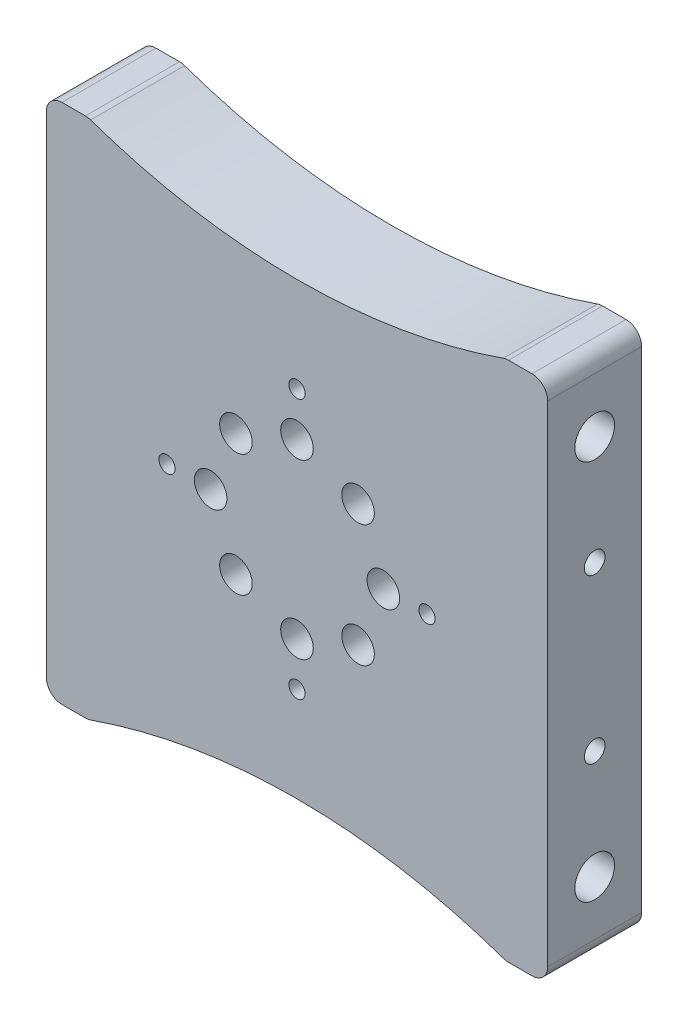
from build123d import *

# Parameters (mm, degrees)
BOSS_EXTRUDE1_DEPTH                         = 19.05
F_1_3_4_CLEARANCE_HOLE1_D                   = 45
F_1_3_4_CLEARANCE_HOLE1_DEPTH               = 5
F_1_4_CLEARANCE_HOLE3_D                     = 6.6
F_1_4_CLEARANCE_HOLE3_DEPTH                 = 19.05
BOSS_EXTRUDE2_DEPTH                         = 19.05
SKETCH21_R                                  = 30
CUT_EXTRUDE1_DEPTH                          = 81.6728269
BOSS_EXTRUDE5_DEPTH                         = 19.05
BOSS_EXTRUDE6_DEPTH                         = 19.05
FILLET2_R                                   = 13
SKETCH29_W                                  = 12.7
SKETCH29_H                                  = 60
BOSS_EXTRUDE7_DEPTH                         = 19.05
BOSS_EXTRUDE8_START                         = -19.05
BOSS_EXTRUDE8_DEPTH                         = 19.05
FILLET3_R                                   = 3.175
F_8_0MM_DOWEL_HOLE1_AT_2_COUNT              = 2
F_8_0MM_DOWEL_HOLE1_AT_2_PITCH              = 77.249249372
TAPPED_HOLE_FOR_M4X0_7_HELICOIL1_AT_2_COUNT = 2
TAPPED_HOLE_FOR_M4X0_7_HELICOIL1_AT_2_PITCH = 33.106821059
F_4_CLEARANCE_HOLE2_D                       = 3.2999934


# Read off the part's stored shape, not the designer's step: Markup2
with BuildPart() as part:
    # Sketch1 → Boss-Extrude1 (new body)
    with BuildSketch(Plane(origin=(0, 0, 0), x_dir=(-1, 0, 0), z_dir=(0, 0, -1))):
        with BuildLine():
            Line((44.45, 0), (44.45, 60))
            Line((44.45, 60), (-44.45, 60))
            Line((-44.45, 60), (-44.45, 0))
            ThreePointArc((-44.45, 0), (0, -44.45), (44.45, 0))
        make_face()
    extrude(amount=-BOSS_EXTRUDE1_DEPTH)

    # 1-3/4 Clearance Hole1
    with Locations(Plane(origin=(0, 0, 0), x_dir=(-1, 0, 0), z_dir=(0, 0, -1))):
        with Locations((-6, 0)):
            Hole(F_1_3_4_CLEARANCE_HOLE1_D / 2, depth=F_1_3_4_CLEARANCE_HOLE1_DEPTH)

    # 1/4 Clearance Hole3
    with Locations(Plane.XY.offset(19.05)):
        with Locations((18.374368671, 12.374368671), (23.499999956, -0.001247108), (18.374368671, -12.374368671), (6, -17.5), (-6.374368671, -12.374368671), (-11.5, 0), (-6.374368671, 12.374368671), (6, 17.5)):
            Hole(F_1_4_CLEARANCE_HOLE3_D / 2, depth=F_1_4_CLEARANCE_HOLE3_DEPTH)

    # Sketch18 → Boss-Extrude2 (add)
    with BuildSketch(Plane(origin=(0, 0, 0), x_dir=(-1, 0, 0), z_dir=(0, 0, -1))):
        with BuildLine():
            Line((-44.45, 0), (-50.45, 0))
            ThreePointArc((-50.45, 0), (-37.430896424, -31.430896424), (-6, -44.45))
            Line((-6, -44.45), (0, -44.45))
            ThreePointArc((0, -44.45), (-31.430896424, -31.430896424), (-44.45, 0))
        make_face()
    extrude(amount=-BOSS_EXTRUDE2_DEPTH)

    # Sketch21 → Cut-Extrude1 (cut, through all)
    with BuildSketch(Plane.XY.offset(19.05)):
        with BuildLine():
            Line((-44.45, 60), (-44.45, 0))
            ThreePointArc((-44.45, 0), (-31.430896424, -31.430896424), (0, -44.45))
            Line((0, -44.45), (6, -44.45))
            ThreePointArc((6, -44.45), (37.430896424, -31.430896424), (50.45, 0))
            Line((50.45, 0), (44.45, 0))
            Line((44.45, 0), (44.45, 60))
            Line((44.45, 60), (-44.45, 60))
        make_face()
        with Locations((5.999999978, -0.000623554)):
            Circle(SKETCH21_R, mode=Mode.SUBTRACT)
    extrude(amount=-CUT_EXTRUDE1_DEPTH, mode=Mode.SUBTRACT)

    # Sketch22 → Boss-Extrude5 (add)
    with BuildSketch(Plane.XY.offset(19.05)):
        with BuildLine():
            Line((44.099999978, -30.000623554), (44.099999978, 29.999376446))
            Line((44.099999978, 29.999376446), (5.999999978, 29.999376446))
            ThreePointArc((5.999999978, 29.999376446), (35.999999978, -0.000623554), (5.999999978, -30.000623554))
            Line((5.999999978, -30.000623554), (44.099999978, -30.000623554))
        make_face()
    boss_extrude5 = extrude(amount=-BOSS_EXTRUDE5_DEPTH)

    # Mirror1: Boss-Extrude5 across plane
    add(boss_extrude5.mirror(Plane(origin=(5.999999978, 0, 0), x_dir=(0, 0, 1), z_dir=(1, 0, 0))))

    # Sketch28 → Boss-Extrude6 (add)
    with BuildSketch(Plane.XY.offset(19.05)):
        with BuildLine():
            Line((-26.798858004, 29.999376446), (38.798858004, 29.999376446))
            ThreePointArc((38.798858004, 29.999376446), (6, 44.448752892), (-26.798858004, 29.999376446))
        make_face()
        with BuildLine():
            ThreePointArc((-26.798858004, -30.000623554), (6, -44.45), (38.798858004, -30.000623554))
            Line((38.798858004, -30.000623554), (-26.798858004, -30.000623554))
        make_face()
    extrude(amount=-BOSS_EXTRUDE6_DEPTH)

    # Fillet2
    fillet2_edges = [part.edges().sort_by_distance(p)[0] for p in [
        (-26.798858004, 29.999376446, 9.525),
        (38.798858004, 29.999376446, 9.525),
        (38.798858004, -30.000623554, 9.525),
        (-26.798858004, -30.000623554, 9.525),
    ]]
    fillet(fillet2_edges, radius=FILLET2_R)

    # Sketch29 → Boss-Extrude7 (add)
    with BuildSketch(Plane.XY):
        with Locations((50.449999978, -0.000623554)):
            Rectangle(SKETCH29_W, SKETCH29_H)
        with Locations((-38.447885426, -0.000623554)):
            Rectangle(SKETCH29_W, SKETCH29_H)
    extrude(amount=BOSS_EXTRUDE7_DEPTH)

    # Sketch40 → Boss-Extrude8 (add)
    with BuildSketch(Plane.XY.offset(19.05).offset(BOSS_EXTRUDE8_START)):
        with BuildLine():
            Line((56.799999978, -30.000623554), (44.097885426, -30.000623554))
            ThreePointArc((44.097885426, -30.000623554), (39.487811488, -30.845492198), (35.476953998, -33.27028228))
            ThreePointArc((35.476953998, -33.27028228), (6, -44.45), (-23.476953998, -33.27028228))
            ThreePointArc((-23.476953998, -33.27028228), (-27.487811488, -30.845492198), (-32.097885426, -30.000623554))
            Line((-32.097885426, -30.000623554), (-44.797885426, -30.000623554))
            Line((-44.797885426, -30.000623554), (-44.797885426, -52.835855224))
            Line((-44.797885426, -52.835855224), (-36.33121876, -52.835855224))
            ThreePointArc((-36.33121876, -52.835855224), (6.001057276, -45.572977311), (48.333333311, -52.835855224))
            Line((48.333333311, -52.835855224), (56.799999978, -52.835855224))
            Line((56.799999978, -52.835855224), (56.799999978, -30.000623554))
        make_face()
        with BuildLine():
            Line((-36.33121876, 52.834608116), (-44.797885426, 52.834608116))
            Line((-44.797885426, 52.834608116), (-44.797885426, 29.999376446))
            Line((-44.797885426, 29.999376446), (-32.097885426, 29.999376446))
            ThreePointArc((-32.097885426, 29.999376446), (-27.487811488, 30.84424509), (-23.476953998, 33.269035172))
            ThreePointArc((-23.476953998, 33.269035172), (6, 44.448752892), (35.476953998, 33.269035172))
            ThreePointArc((35.476953998, 33.269035172), (39.487811488, 30.84424509), (44.097885426, 29.999376446))
            Line((44.097885426, 29.999376446), (56.799999978, 29.999376446))
            Line((56.799999978, 29.999376446), (56.799999978, 52.834608116))
            Line((56.799999978, 52.834608116), (48.333333311, 52.834608116))
            ThreePointArc((48.333333311, 52.834608116), (6.001057276, 45.571730203), (-36.33121876, 52.834608116))
        make_face()
    extrude(amount=BOSS_EXTRUDE8_DEPTH)

    # Fillet3
    fillet3_edges = [part.edges().sort_by_distance(p)[0] for p in [
        (-44.797885426, -52.835855224, 9.525),
        (-36.33121876, -52.835855224, 9.525),
        (48.333333311, -52.835855224, 9.525),
        (56.799999978, -52.835855224, 9.525),
        (56.799999978, 52.834608116, 9.525),
        (48.333333311, 52.834608116, 9.525),
        (-36.33121876, 52.834608116, 9.525),
        (-44.797885426, 52.834608116, 9.525),
    ]]
    fillet(fillet3_edges, radius=FILLET3_R)

    # Sketch49 → Ø8.0mm Dowel Hole1 (revolve, cut)
    with BuildSketch(Plane(origin=(56.799999978, 38.624001078, 9.525), x_dir=(0, 0, -1), z_dir=(0, 1, 0))):
        Polygon((0, 0), (0, 27.818463992), (4.025, 25.4), (4.025, 0), align=None)
    f_8_0mm_dowel_hole1 = revolve(axis=Axis((63.149999978, 38.624001078, 9.525), (-1, 0, 0)), mode=Mode.SUBTRACT)

    # Ø8.0mm Dowel Hole1 at 2: Ø8.0mm Dowel Hole1 ×2
    with Locations(*[(0, -i * F_8_0MM_DOWEL_HOLE1_AT_2_PITCH, 0) for i in range(1, F_8_0MM_DOWEL_HOLE1_AT_2_COUNT)]):
        add(f_8_0mm_dowel_hole1, mode=Mode.SUBTRACT)

    # Sketch52 → Tapped Hole for M4x0.7 Helicoil1 (revolve, cut)
    with BuildSketch(Plane(origin=(56.799999978, 16.552787003, 9.525), x_dir=(0, 0, -1), z_dir=(0, 1, 0))):
        Polygon((0, 0), (0, 13.4538073), (2.1, 12.192), (2.1, 0), align=None)
    tapped_hole_for_m4x0_7_helicoil1 = revolve(axis=Axis((63.149999978, 16.552787003, 9.525), (-1, 0, 0)), mode=Mode.SUBTRACT)

    # Tapped Hole for M4x0.7 Helicoil1 at 2: Tapped Hole for M4x0.7 Helicoil1 ×2
    with Locations(*[(0, -i * TAPPED_HOLE_FOR_M4X0_7_HELICOIL1_AT_2_PITCH, 0) for i in range(1, TAPPED_HOLE_FOR_M4X0_7_HELICOIL1_AT_2_COUNT)]):
        add(tapped_hole_for_m4x0_7_helicoil1, mode=Mode.SUBTRACT)

    # Mirror6: Ø8.0mm Dowel Hole1, Tapped Hole for M4x0.7 Helicoil1 across plane
    add(f_8_0mm_dowel_hole1.mirror(Plane(origin=(5.999999978, 0, 0), x_dir=(0, 0, 1), z_dir=(1, 0, 0))), mode=Mode.SUBTRACT)
    add(tapped_hole_for_m4x0_7_helicoil1.mirror(Plane(origin=(5.999999978, 0, 0), x_dir=(0, 0, 1), z_dir=(1, 0, 0))), mode=Mode.SUBTRACT)

    # Mirror6 copy 1 sketch → Mirror6 copy 1 (revolve, cut)
    with BuildSketch(Plane(origin=(-44.800000022, -38.625248294, 9.525), x_dir=(0, 0, -1), z_dir=(0, 1, 0))):
        Polygon((0, 0), (0, -27.818463992), (4.025, -25.4), (4.025, 0), align=None)
    revolve(axis=Axis((-51.150000022, -38.625248294, 9.525), (-1, 0, 0)), mode=Mode.SUBTRACT)

    # Mirror6 copy 2 sketch → Mirror6 copy 2 (revolve, cut)
    with BuildSketch(Plane(origin=(-44.800000022, -16.554034056, 9.525), x_dir=(0, 0, -1), z_dir=(0, 1, 0))):
        Polygon((0, 0), (0, -13.4538073), (2.1, -12.192), (2.1, 0), align=None)
    revolve(axis=Axis((-51.150000022, -16.554034056, 9.525), (-1, 0, 0)), mode=Mode.SUBTRACT)

    # #4 Clearance Hole2 (through all)
    with Locations(Plane.XY.offset(19.05)):
        with Locations((32.350000005, 0), (6, 26.350000005), (-20.350000005, 0), (6, -26.350000005)):
            Hole(F_4_CLEARANCE_HOLE2_D / 2)


solid = part.part
